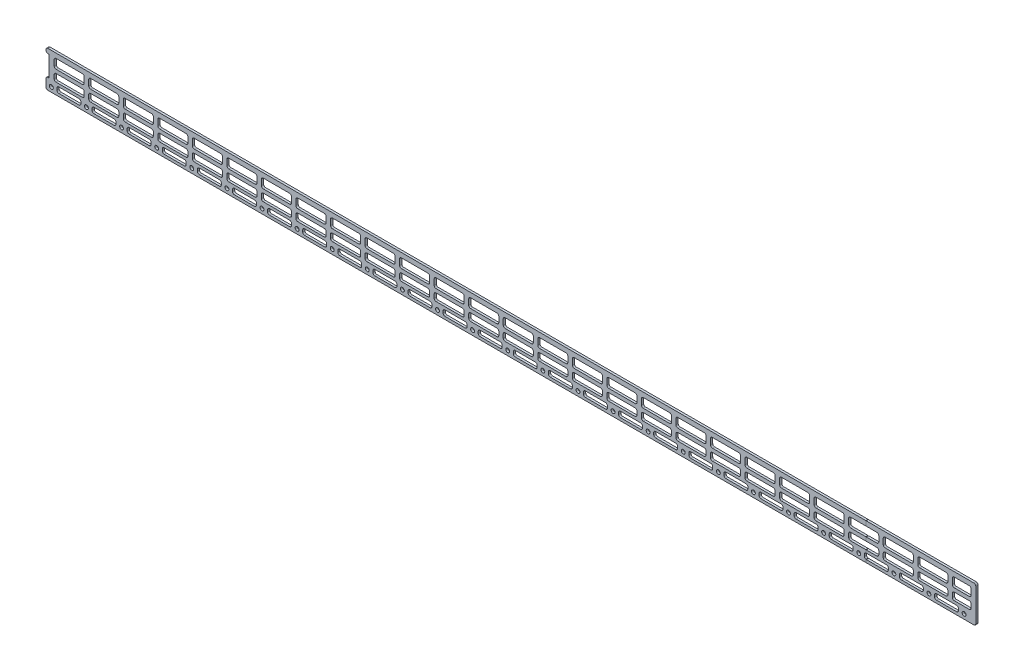
from build123d import *

# Parameters (mm, degrees)
SKETCH_1_R          = 1.05
SKETCH_1_W          = 16.14
SKETCH_1_H          = 4
SKETCH_1_H_2        = 5
SKETCH_1_W_2        = 12.84
SKETCH_1_H_3        = 3
SKETCH_1_W_3        = 10.08
EXTRUDE_1_DEPTH     = 1.2
FILLET_1_R          = 1
SKETCH_2_W          = 0.2
SKETCH_2_H          = 30.488624859
CUT_EXTRUDE_1_DEPTH = 10


with BuildPart() as part:
    # 草图1 → 凸台-拉伸1 (new body)
    with BuildSketch(Plane.XY):
        Polygon((249.5, -9.75), (-249.5, -9.75), (-249.5, -3.75), (-247.82, -3.75), (-247.82, 7.25), (-249.5, 7.25), (-249.5, 9.75), (249.5, 9.75), align=None)
        with Locations((-246.62, -7.25)):
            Circle(SKETCH_1_R, mode=Mode.SUBTRACT)
        with Locations((-227.78, -7.25)):
            Circle(SKETCH_1_R, mode=Mode.SUBTRACT)
        with Locations((-208.94, -7.25)):
            Circle(SKETCH_1_R, mode=Mode.SUBTRACT)
        with Locations((-190.1, -7.25)):
            Circle(SKETCH_1_R, mode=Mode.SUBTRACT)
        with Locations((-171.26, -7.25)):
            Circle(SKETCH_1_R, mode=Mode.SUBTRACT)
        with Locations((-152.42, -7.25)):
            Circle(SKETCH_1_R, mode=Mode.SUBTRACT)
        with Locations((-133.58, -7.25)):
            Circle(SKETCH_1_R, mode=Mode.SUBTRACT)
        with Locations((-114.74, -7.25)):
            Circle(SKETCH_1_R, mode=Mode.SUBTRACT)
        with Locations((-95.9, -7.25)):
            Circle(SKETCH_1_R, mode=Mode.SUBTRACT)
        with Locations((-77.06, -7.25)):
            Circle(SKETCH_1_R, mode=Mode.SUBTRACT)
        with Locations((-58.22, -7.25)):
            Circle(SKETCH_1_R, mode=Mode.SUBTRACT)
        with Locations((-39.38, -7.25)):
            Circle(SKETCH_1_R, mode=Mode.SUBTRACT)
        with Locations((-20.54, -7.25)):
            Circle(SKETCH_1_R, mode=Mode.SUBTRACT)
        with Locations((-1.7, -7.25)):
            Circle(SKETCH_1_R, mode=Mode.SUBTRACT)
        with Locations((17.14, -7.25)):
            Circle(SKETCH_1_R, mode=Mode.SUBTRACT)
        with Locations((35.98, -7.25)):
            Circle(SKETCH_1_R, mode=Mode.SUBTRACT)
        with Locations((54.82, -7.25)):
            Circle(SKETCH_1_R, mode=Mode.SUBTRACT)
        with Locations((73.66, -7.25)):
            Circle(SKETCH_1_R, mode=Mode.SUBTRACT)
        with Locations((92.5, -7.25)):
            Circle(SKETCH_1_R, mode=Mode.SUBTRACT)
        with Locations((111.34, -7.25)):
            Circle(SKETCH_1_R, mode=Mode.SUBTRACT)
        with Locations((130.18, -7.25)):
            Circle(SKETCH_1_R, mode=Mode.SUBTRACT)
        with Locations((149.02, -7.25)):
            Circle(SKETCH_1_R, mode=Mode.SUBTRACT)
        with Locations((167.86, -7.25)):
            Circle(SKETCH_1_R, mode=Mode.SUBTRACT)
        with Locations((186.7, -7.25)):
            Circle(SKETCH_1_R, mode=Mode.SUBTRACT)
        with Locations((205.54, -7.25)):
            Circle(SKETCH_1_R, mode=Mode.SUBTRACT)
        with Locations((224.38, -7.25)):
            Circle(SKETCH_1_R, mode=Mode.SUBTRACT)
        with Locations((243.22, -7.25)):
            Circle(SKETCH_1_R, mode=Mode.SUBTRACT)
        with Locations((-237.05, -1.75)):
            Rectangle(SKETCH_1_W, SKETCH_1_H, mode=Mode.SUBTRACT)
        with Locations((-237.05, 4.75)):
            Rectangle(SKETCH_1_W, SKETCH_1_H_2, mode=Mode.SUBTRACT)
        with Locations((-218.36, -6.75)):
            Rectangle(SKETCH_1_W_2, SKETCH_1_H_3, mode=Mode.SUBTRACT)
        with Locations((-237.2, -6.75)):
            Rectangle(SKETCH_1_W_2, SKETCH_1_H_3, mode=Mode.SUBTRACT)
        with Locations((-199.52, -6.75)):
            Rectangle(SKETCH_1_W_2, SKETCH_1_H_3, mode=Mode.SUBTRACT)
        with Locations((-180.68, -6.75)):
            Rectangle(SKETCH_1_W_2, SKETCH_1_H_3, mode=Mode.SUBTRACT)
        with Locations((-161.84, -6.75)):
            Rectangle(SKETCH_1_W_2, SKETCH_1_H_3, mode=Mode.SUBTRACT)
        with Locations((-143, -6.75)):
            Rectangle(SKETCH_1_W_2, SKETCH_1_H_3, mode=Mode.SUBTRACT)
        with Locations((-124.16, -6.75)):
            Rectangle(SKETCH_1_W_2, SKETCH_1_H_3, mode=Mode.SUBTRACT)
        with Locations((-105.32, -6.75)):
            Rectangle(SKETCH_1_W_2, SKETCH_1_H_3, mode=Mode.SUBTRACT)
        with Locations((-86.48, -6.75)):
            Rectangle(SKETCH_1_W_2, SKETCH_1_H_3, mode=Mode.SUBTRACT)
        with Locations((-67.64, -6.75)):
            Rectangle(SKETCH_1_W_2, SKETCH_1_H_3, mode=Mode.SUBTRACT)
        with Locations((-48.8, -6.75)):
            Rectangle(SKETCH_1_W_2, SKETCH_1_H_3, mode=Mode.SUBTRACT)
        with Locations((-29.96, -6.75)):
            Rectangle(SKETCH_1_W_2, SKETCH_1_H_3, mode=Mode.SUBTRACT)
        with Locations((-11.12, -6.75)):
            Rectangle(SKETCH_1_W_2, SKETCH_1_H_3, mode=Mode.SUBTRACT)
        with Locations((7.72, -6.75)):
            Rectangle(SKETCH_1_W_2, SKETCH_1_H_3, mode=Mode.SUBTRACT)
        with Locations((26.56, -6.75)):
            Rectangle(SKETCH_1_W_2, SKETCH_1_H_3, mode=Mode.SUBTRACT)
        with Locations((45.4, -6.75)):
            Rectangle(SKETCH_1_W_2, SKETCH_1_H_3, mode=Mode.SUBTRACT)
        with Locations((64.24, -6.75)):
            Rectangle(SKETCH_1_W_2, SKETCH_1_H_3, mode=Mode.SUBTRACT)
        with Locations((83.08, -6.75)):
            Rectangle(SKETCH_1_W_2, SKETCH_1_H_3, mode=Mode.SUBTRACT)
        with Locations((101.92, -6.75)):
            Rectangle(SKETCH_1_W_2, SKETCH_1_H_3, mode=Mode.SUBTRACT)
        with Locations((120.76, -6.75)):
            Rectangle(SKETCH_1_W_2, SKETCH_1_H_3, mode=Mode.SUBTRACT)
        with Locations((139.6, -6.75)):
            Rectangle(SKETCH_1_W_2, SKETCH_1_H_3, mode=Mode.SUBTRACT)
        with Locations((158.44, -6.75)):
            Rectangle(SKETCH_1_W_2, SKETCH_1_H_3, mode=Mode.SUBTRACT)
        with Locations((177.28, -6.75)):
            Rectangle(SKETCH_1_W_2, SKETCH_1_H_3, mode=Mode.SUBTRACT)
        with Locations((196.12, -6.75)):
            Rectangle(SKETCH_1_W_2, SKETCH_1_H_3, mode=Mode.SUBTRACT)
        with Locations((214.96, -6.75)):
            Rectangle(SKETCH_1_W_2, SKETCH_1_H_3, mode=Mode.SUBTRACT)
        with Locations((233.8, -6.75)):
            Rectangle(SKETCH_1_W_2, SKETCH_1_H_3, mode=Mode.SUBTRACT)
        with Locations((241.96, 4.75)):
            Rectangle(SKETCH_1_W_3, SKETCH_1_H_2, mode=Mode.SUBTRACT)
        with Locations((-218.51, 4.75)):
            Rectangle(SKETCH_1_W, SKETCH_1_H_2, mode=Mode.SUBTRACT)
        with Locations((-218.51, -1.75)):
            Rectangle(SKETCH_1_W, SKETCH_1_H, mode=Mode.SUBTRACT)
        with Locations((-199.97, 4.75)):
            Rectangle(SKETCH_1_W, SKETCH_1_H_2, mode=Mode.SUBTRACT)
        with Locations((-199.97, -1.75)):
            Rectangle(SKETCH_1_W, SKETCH_1_H, mode=Mode.SUBTRACT)
        with Locations((-181.43, 4.75)):
            Rectangle(SKETCH_1_W, SKETCH_1_H_2, mode=Mode.SUBTRACT)
        with Locations((-181.43, -1.75)):
            Rectangle(SKETCH_1_W, SKETCH_1_H, mode=Mode.SUBTRACT)
        with Locations((-162.89, 4.75)):
            Rectangle(SKETCH_1_W, SKETCH_1_H_2, mode=Mode.SUBTRACT)
        with Locations((-162.89, -1.75)):
            Rectangle(SKETCH_1_W, SKETCH_1_H, mode=Mode.SUBTRACT)
        with Locations((-144.35, 4.75)):
            Rectangle(SKETCH_1_W, SKETCH_1_H_2, mode=Mode.SUBTRACT)
        with Locations((-144.35, -1.75)):
            Rectangle(SKETCH_1_W, SKETCH_1_H, mode=Mode.SUBTRACT)
        with Locations((-125.81, 4.75)):
            Rectangle(SKETCH_1_W, SKETCH_1_H_2, mode=Mode.SUBTRACT)
        with Locations((-125.81, -1.75)):
            Rectangle(SKETCH_1_W, SKETCH_1_H, mode=Mode.SUBTRACT)
        with Locations((-107.27, 4.75)):
            Rectangle(SKETCH_1_W, SKETCH_1_H_2, mode=Mode.SUBTRACT)
        with Locations((-107.27, -1.75)):
            Rectangle(SKETCH_1_W, SKETCH_1_H, mode=Mode.SUBTRACT)
        with Locations((-88.73, 4.75)):
            Rectangle(SKETCH_1_W, SKETCH_1_H_2, mode=Mode.SUBTRACT)
        with Locations((-88.73, -1.75)):
            Rectangle(SKETCH_1_W, SKETCH_1_H, mode=Mode.SUBTRACT)
        with Locations((-70.19, 4.75)):
            Rectangle(SKETCH_1_W, SKETCH_1_H_2, mode=Mode.SUBTRACT)
        with Locations((-70.19, -1.75)):
            Rectangle(SKETCH_1_W, SKETCH_1_H, mode=Mode.SUBTRACT)
        with Locations((-51.65, 4.75)):
            Rectangle(SKETCH_1_W, SKETCH_1_H_2, mode=Mode.SUBTRACT)
        with Locations((-51.65, -1.75)):
            Rectangle(SKETCH_1_W, SKETCH_1_H, mode=Mode.SUBTRACT)
        with Locations((-33.11, 4.75)):
            Rectangle(SKETCH_1_W, SKETCH_1_H_2, mode=Mode.SUBTRACT)
        with Locations((-33.11, -1.75)):
            Rectangle(SKETCH_1_W, SKETCH_1_H, mode=Mode.SUBTRACT)
        with Locations((-14.57, 4.75)):
            Rectangle(SKETCH_1_W, SKETCH_1_H_2, mode=Mode.SUBTRACT)
        with Locations((-14.57, -1.75)):
            Rectangle(SKETCH_1_W, SKETCH_1_H, mode=Mode.SUBTRACT)
        with Locations((3.97, 4.75)):
            Rectangle(SKETCH_1_W, SKETCH_1_H_2, mode=Mode.SUBTRACT)
        with Locations((3.97, -1.75)):
            Rectangle(SKETCH_1_W, SKETCH_1_H, mode=Mode.SUBTRACT)
        with Locations((22.51, 4.75)):
            Rectangle(SKETCH_1_W, SKETCH_1_H_2, mode=Mode.SUBTRACT)
        with Locations((22.51, -1.75)):
            Rectangle(SKETCH_1_W, SKETCH_1_H, mode=Mode.SUBTRACT)
        with Locations((41.05, 4.75)):
            Rectangle(SKETCH_1_W, SKETCH_1_H_2, mode=Mode.SUBTRACT)
        with Locations((41.05, -1.75)):
            Rectangle(SKETCH_1_W, SKETCH_1_H, mode=Mode.SUBTRACT)
        with Locations((59.59, 4.75)):
            Rectangle(SKETCH_1_W, SKETCH_1_H_2, mode=Mode.SUBTRACT)
        with Locations((59.59, -1.75)):
            Rectangle(SKETCH_1_W, SKETCH_1_H, mode=Mode.SUBTRACT)
        with Locations((78.13, 4.75)):
            Rectangle(SKETCH_1_W, SKETCH_1_H_2, mode=Mode.SUBTRACT)
        with Locations((78.13, -1.75)):
            Rectangle(SKETCH_1_W, SKETCH_1_H, mode=Mode.SUBTRACT)
        with Locations((96.67, 4.75)):
            Rectangle(SKETCH_1_W, SKETCH_1_H_2, mode=Mode.SUBTRACT)
        with Locations((96.67, -1.75)):
            Rectangle(SKETCH_1_W, SKETCH_1_H, mode=Mode.SUBTRACT)
        with Locations((115.21, 4.75)):
            Rectangle(SKETCH_1_W, SKETCH_1_H_2, mode=Mode.SUBTRACT)
        with Locations((115.21, -1.75)):
            Rectangle(SKETCH_1_W, SKETCH_1_H, mode=Mode.SUBTRACT)
        with Locations((133.75, 4.75)):
            Rectangle(SKETCH_1_W, SKETCH_1_H_2, mode=Mode.SUBTRACT)
        with Locations((133.75, -1.75)):
            Rectangle(SKETCH_1_W, SKETCH_1_H, mode=Mode.SUBTRACT)
        with Locations((152.29, 4.75)):
            Rectangle(SKETCH_1_W, SKETCH_1_H_2, mode=Mode.SUBTRACT)
        with Locations((152.29, -1.75)):
            Rectangle(SKETCH_1_W, SKETCH_1_H, mode=Mode.SUBTRACT)
        with Locations((170.83, 4.75)):
            Rectangle(SKETCH_1_W, SKETCH_1_H_2, mode=Mode.SUBTRACT)
        with Locations((170.83, -1.75)):
            Rectangle(SKETCH_1_W, SKETCH_1_H, mode=Mode.SUBTRACT)
        with Locations((189.37, 4.75)):
            Rectangle(SKETCH_1_W, SKETCH_1_H_2, mode=Mode.SUBTRACT)
        with Locations((189.37, -1.75)):
            Rectangle(SKETCH_1_W, SKETCH_1_H, mode=Mode.SUBTRACT)
        with Locations((207.91, 4.75)):
            Rectangle(SKETCH_1_W, SKETCH_1_H_2, mode=Mode.SUBTRACT)
        with Locations((207.91, -1.75)):
            Rectangle(SKETCH_1_W, SKETCH_1_H, mode=Mode.SUBTRACT)
        with Locations((226.45, 4.75)):
            Rectangle(SKETCH_1_W, SKETCH_1_H_2, mode=Mode.SUBTRACT)
        with Locations((226.45, -1.75)):
            Rectangle(SKETCH_1_W, SKETCH_1_H, mode=Mode.SUBTRACT)
        with Locations((241.96, -1.75)):
            Rectangle(SKETCH_1_W_3, SKETCH_1_H, mode=Mode.SUBTRACT)
    extrude(amount=EXTRUDE_1_DEPTH)

    # 圆角1
    fillet_1_edges = [part.edges().sort_by_distance(p)[0] for p in [
        (141.82, -3.75, 0.6),
        (141.82, 0.25, 0.6),
        (125.68, 0.25, 0.6),
        (125.68, -3.75, 0.6),
        (125.68, 7.25, 0.6),
        (125.68, 2.25, 0.6),
        (141.82, 2.25, 0.6),
        (141.82, 7.25, 0.6),
        (160.36, -3.75, 0.6),
        (160.36, 0.25, 0.6),
        (144.22, 0.25, 0.6),
        (144.22, -3.75, 0.6),
        (144.22, 7.25, 0.6),
        (144.22, 2.25, 0.6),
        (160.36, 2.25, 0.6),
        (160.36, 7.25, 0.6),
        (178.9, -3.75, 0.6),
        (178.9, 0.25, 0.6),
        (162.76, 0.25, 0.6),
        (162.76, -3.75, 0.6),
        (162.76, 7.25, 0.6),
        (162.76, 2.25, 0.6),
        (178.9, 2.25, 0.6),
        (178.9, 7.25, 0.6),
        (197.44, -3.75, 0.6),
        (197.44, 0.25, 0.6),
        (181.3, 0.25, 0.6),
        (181.3, -3.75, 0.6),
        (181.3, 7.25, 0.6),
        (181.3, 2.25, 0.6),
        (197.44, 2.25, 0.6),
        (197.44, 7.25, 0.6),
        (215.98, -3.75, 0.6),
        (215.98, 0.25, 0.6),
        (199.84, 0.25, 0.6),
        (199.84, -3.75, 0.6),
        (199.84, 7.25, 0.6),
        (199.84, 2.25, 0.6),
        (215.98, 2.25, 0.6),
        (215.98, 7.25, 0.6),
        (234.52, -3.75, 0.6),
        (234.52, 0.25, 0.6),
        (218.38, 0.25, 0.6),
        (218.38, -3.75, 0.6),
        (218.38, 7.25, 0.6),
        (218.38, 2.25, 0.6),
        (234.52, 2.25, 0.6),
        (234.52, 7.25, 0.6),
        (-228.98, -3.75, 0.6),
        (-228.98, 0.25, 0.6),
        (-245.12, 0.25, 0.6),
        (-245.12, -3.75, 0.6),
        (-249.5, 9.75, 0.6),
        (249.5, 9.75, 0.6),
        (249.5, -9.75, 0.6),
        (-249.5, -9.75, 0.6),
        (-249.5, -3.75, 0.6),
        (-191.9, -3.75, 0.6),
        (-191.9, 0.25, 0.6),
        (-208.04, 0.25, 0.6),
        (-208.04, -3.75, 0.6),
        (-249.5, 7.25, 0.6),
        (-243.62, -5.25, 0.6),
        (-243.62, -8.25, 0.6),
        (-230.78, -8.25, 0.6),
        (-230.78, -5.25, 0.6),
        (-245.12, 7.25, 0.6),
        (-245.12, 2.25, 0.6),
        (-228.98, 2.25, 0.6),
        (-228.98, 7.25, 0.6),
        (-210.44, -3.75, 0.6),
        (-210.44, 0.25, 0.6),
        (-226.58, 0.25, 0.6),
        (-226.58, -3.75, 0.6),
        (-226.58, 7.25, 0.6),
        (-226.58, 2.25, 0.6),
        (-210.44, 2.25, 0.6),
        (-210.44, 7.25, 0.6),
        (-208.04, 7.25, 0.6),
        (-208.04, 2.25, 0.6),
        (-191.9, 2.25, 0.6),
        (-191.9, 7.25, 0.6),
        (-173.36, -3.75, 0.6),
        (-173.36, 0.25, 0.6),
        (-189.5, 0.25, 0.6),
        (-189.5, -3.75, 0.6),
        (-189.5, 7.25, 0.6),
        (-189.5, 2.25, 0.6),
        (-173.36, 2.25, 0.6),
        (-173.36, 7.25, 0.6),
        (-154.82, -3.75, 0.6),
        (-154.82, 0.25, 0.6),
        (-170.96, 0.25, 0.6),
        (-170.96, -3.75, 0.6),
        (-170.96, 7.25, 0.6),
        (-170.96, 2.25, 0.6),
        (-154.82, 2.25, 0.6),
        (-154.82, 7.25, 0.6),
        (-136.28, -3.75, 0.6),
        (-136.28, 0.25, 0.6),
        (-152.42, 0.25, 0.6),
        (-152.42, -3.75, 0.6),
        (-152.42, 7.25, 0.6),
        (-152.42, 2.25, 0.6),
        (-136.28, 2.25, 0.6),
        (-136.28, 7.25, 0.6),
        (-117.74, -3.75, 0.6),
        (-117.74, 0.25, 0.6),
        (-133.88, 0.25, 0.6),
        (-133.88, -3.75, 0.6),
        (-133.88, 7.25, 0.6),
        (-133.88, 2.25, 0.6),
        (-117.74, 2.25, 0.6),
        (-117.74, 7.25, 0.6),
        (-99.2, -3.75, 0.6),
        (-99.2, 0.25, 0.6),
        (-115.34, 0.25, 0.6),
        (-115.34, -3.75, 0.6),
        (-115.34, 7.25, 0.6),
        (-115.34, 2.25, 0.6),
        (-99.2, 2.25, 0.6),
        (-99.2, 7.25, 0.6),
        (-80.66, -3.75, 0.6),
        (-80.66, 0.25, 0.6),
        (-96.8, 0.25, 0.6),
        (-96.8, -3.75, 0.6),
        (-96.8, 7.25, 0.6),
        (-96.8, 2.25, 0.6),
        (-80.66, 2.25, 0.6),
        (-80.66, 7.25, 0.6),
        (-62.12, -3.75, 0.6),
        (-62.12, 0.25, 0.6),
        (-78.26, 0.25, 0.6),
        (-78.26, -3.75, 0.6),
        (-78.26, 7.25, 0.6),
        (-78.26, 2.25, 0.6),
        (-62.12, 2.25, 0.6),
        (-62.12, 7.25, 0.6),
        (-43.58, -3.75, 0.6),
        (-43.58, 0.25, 0.6),
        (-59.72, 0.25, 0.6),
        (-59.72, -3.75, 0.6),
        (-59.72, 7.25, 0.6),
        (-59.72, 2.25, 0.6),
        (-43.58, 2.25, 0.6),
        (-43.58, 7.25, 0.6),
        (-25.04, -3.75, 0.6),
        (-25.04, 0.25, 0.6),
        (-41.18, 0.25, 0.6),
        (-41.18, -3.75, 0.6),
        (-41.18, 7.25, 0.6),
        (-41.18, 2.25, 0.6),
        (-25.04, 2.25, 0.6),
        (-25.04, 7.25, 0.6),
        (-6.5, -3.75, 0.6),
        (-6.5, 0.25, 0.6),
        (-22.64, 0.25, 0.6),
        (-22.64, -3.75, 0.6),
        (-22.64, 7.25, 0.6),
        (-22.64, 2.25, 0.6),
        (-6.5, 2.25, 0.6),
        (-6.5, 7.25, 0.6),
        (-211.94, -5.25, 0.6),
        (-224.78, -5.25, 0.6),
        (-224.78, -8.25, 0.6),
        (-211.94, -8.25, 0.6),
        (-193.1, -5.25, 0.6),
        (-205.94, -5.25, 0.6),
        (-205.94, -8.25, 0.6),
        (-193.1, -8.25, 0.6),
        (-174.26, -5.25, 0.6),
        (-187.1, -5.25, 0.6),
        (-187.1, -8.25, 0.6),
        (-174.26, -8.25, 0.6),
        (-155.42, -5.25, 0.6),
        (-168.26, -5.25, 0.6),
        (-168.26, -8.25, 0.6),
        (-155.42, -8.25, 0.6),
        (-136.58, -5.25, 0.6),
        (-149.42, -5.25, 0.6),
        (-149.42, -8.25, 0.6),
        (-136.58, -8.25, 0.6),
        (-117.74, -5.25, 0.6),
        (-130.58, -5.25, 0.6),
        (-130.58, -8.25, 0.6),
        (-117.74, -8.25, 0.6),
        (-98.9, -5.25, 0.6),
        (-111.74, -5.25, 0.6),
        (-111.74, -8.25, 0.6),
        (-98.9, -8.25, 0.6),
        (-80.06, -5.25, 0.6),
        (-92.9, -5.25, 0.6),
        (-92.9, -8.25, 0.6),
        (-80.06, -8.25, 0.6),
        (-61.22, -5.25, 0.6),
        (-74.06, -5.25, 0.6),
        (-74.06, -8.25, 0.6),
        (-61.22, -8.25, 0.6),
        (-42.38, -5.25, 0.6),
        (-55.22, -5.25, 0.6),
        (-55.22, -8.25, 0.6),
        (-42.38, -8.25, 0.6),
        (-23.54, -5.25, 0.6),
        (-36.38, -5.25, 0.6),
        (-36.38, -8.25, 0.6),
        (-23.54, -8.25, 0.6),
        (-4.7, -5.25, 0.6),
        (-17.54, -5.25, 0.6),
        (-17.54, -8.25, 0.6),
        (-4.7, -8.25, 0.6),
        (14.14, -5.25, 0.6),
        (1.3, -5.25, 0.6),
        (1.3, -8.25, 0.6),
        (14.14, -8.25, 0.6),
        (32.98, -5.25, 0.6),
        (20.14, -5.25, 0.6),
        (20.14, -8.25, 0.6),
        (32.98, -8.25, 0.6),
        (51.82, -5.25, 0.6),
        (38.98, -5.25, 0.6),
        (38.98, -8.25, 0.6),
        (51.82, -8.25, 0.6),
        (70.66, -5.25, 0.6),
        (57.82, -5.25, 0.6),
        (57.82, -8.25, 0.6),
        (70.66, -8.25, 0.6),
        (89.5, -5.25, 0.6),
        (76.66, -5.25, 0.6),
        (76.66, -8.25, 0.6),
        (89.5, -8.25, 0.6),
        (108.34, -5.25, 0.6),
        (95.5, -5.25, 0.6),
        (95.5, -8.25, 0.6),
        (108.34, -8.25, 0.6),
        (127.18, -5.25, 0.6),
        (114.34, -5.25, 0.6),
        (114.34, -8.25, 0.6),
        (127.18, -8.25, 0.6),
        (146.02, -5.25, 0.6),
        (133.18, -5.25, 0.6),
        (133.18, -8.25, 0.6),
        (146.02, -8.25, 0.6),
        (164.86, -5.25, 0.6),
        (152.02, -5.25, 0.6),
        (152.02, -8.25, 0.6),
        (164.86, -8.25, 0.6),
        (183.7, -5.25, 0.6),
        (170.86, -5.25, 0.6),
        (170.86, -8.25, 0.6),
        (183.7, -8.25, 0.6),
        (202.54, -5.25, 0.6),
        (189.7, -5.25, 0.6),
        (189.7, -8.25, 0.6),
        (202.54, -8.25, 0.6),
        (221.38, -5.25, 0.6),
        (208.54, -5.25, 0.6),
        (208.54, -8.25, 0.6),
        (221.38, -8.25, 0.6),
        (240.22, -5.25, 0.6),
        (227.38, -5.25, 0.6),
        (227.38, -8.25, 0.6),
        (240.22, -8.25, 0.6),
        (12.04, -3.75, 0.6),
        (12.04, 0.25, 0.6),
        (-4.1, 0.25, 0.6),
        (-4.1, -3.75, 0.6),
        (-4.1, 7.25, 0.6),
        (-4.1, 2.25, 0.6),
        (12.04, 2.25, 0.6),
        (12.04, 7.25, 0.6),
        (247, 7.25, 0.6),
        (236.92, 7.25, 0.6),
        (236.92, 2.25, 0.6),
        (247, 2.25, 0.6),
        (247, -3.75, 0.6),
        (247, 0.25, 0.6),
        (236.92, 0.25, 0.6),
        (236.92, -3.75, 0.6),
        (30.58, -3.75, 0.6),
        (30.58, 0.25, 0.6),
        (14.44, 0.25, 0.6),
        (14.44, -3.75, 0.6),
        (14.44, 7.25, 0.6),
        (14.44, 2.25, 0.6),
        (30.58, 2.25, 0.6),
        (30.58, 7.25, 0.6),
        (49.12, -3.75, 0.6),
        (49.12, 0.25, 0.6),
        (32.98, 0.25, 0.6),
        (32.98, -3.75, 0.6),
        (32.98, 7.25, 0.6),
        (32.98, 2.25, 0.6),
        (49.12, 2.25, 0.6),
        (49.12, 7.25, 0.6),
        (67.66, -3.75, 0.6),
        (67.66, 0.25, 0.6),
        (51.52, 0.25, 0.6),
        (51.52, -3.75, 0.6),
        (51.52, 7.25, 0.6),
        (51.52, 2.25, 0.6),
        (67.66, 2.25, 0.6),
        (67.66, 7.25, 0.6),
        (86.2, -3.75, 0.6),
        (86.2, 0.25, 0.6),
        (70.06, 0.25, 0.6),
        (70.06, -3.75, 0.6),
        (70.06, 7.25, 0.6),
        (70.06, 2.25, 0.6),
        (86.2, 2.25, 0.6),
        (86.2, 7.25, 0.6),
        (104.74, -3.75, 0.6),
        (104.74, 0.25, 0.6),
        (88.6, 0.25, 0.6),
        (88.6, -3.75, 0.6),
        (88.6, 7.25, 0.6),
        (88.6, 2.25, 0.6),
        (104.74, 2.25, 0.6),
        (104.74, 7.25, 0.6),
        (123.28, -3.75, 0.6),
        (123.28, 0.25, 0.6),
        (107.14, 0.25, 0.6),
        (107.14, -3.75, 0.6),
        (107.14, 7.25, 0.6),
        (107.14, 2.25, 0.6),
        (123.28, 2.25, 0.6),
        (123.28, 7.25, 0.6),
    ]]
    fillet(fillet_1_edges, radius=FILLET_1_R)

    # 草图2 → 切除-拉伸1 (cut)
    with BuildSketch(Plane.XY.offset(1.2)):
        with Locations((190.6, 4.148195616)):
            Rectangle(SKETCH_2_W, SKETCH_2_H)
    extrude(amount=-CUT_EXTRUDE_1_DEPTH, mode=Mode.SUBTRACT)


with BuildPart() as cut_extrude_1_piece_1:
    # of the separate pieces the step leaves, piece 1, a body of its own (cut_extrude_1_pieces)
    add(part.part.solids().sort_by_distance((190.5, -9.75, 0))[0])


with BuildPart() as cut_extrude_1_piece_2:
    # of the separate pieces the step leaves, piece 2, a body of its own (cut_extrude_1_pieces)
    add(part.part.solids().sort_by_distance((248.5, -9.75, 0))[0])


solid = Compound([cut_extrude_1_piece_1.part, cut_extrude_1_piece_2.part])
